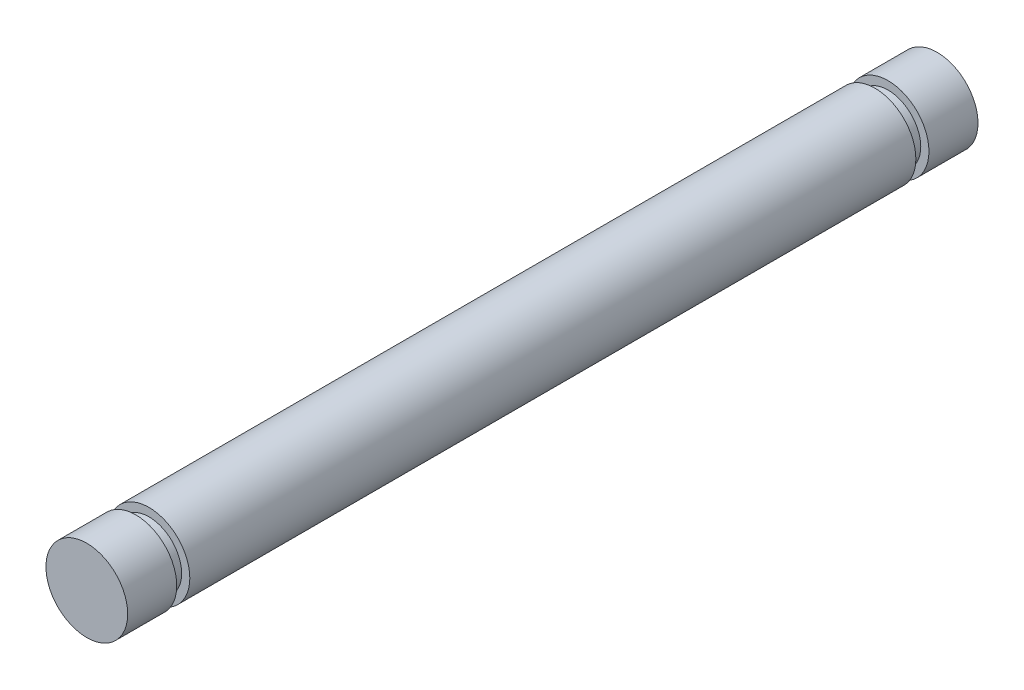
from build123d import *


with BuildPart() as part:
    # Sketch1 → Revolve1 (revolve)
    with BuildSketch(Plane(origin=(0, 0, 0), x_dir=(0, 0, -1), z_dir=(1, 0, 0))):
        Polygon((-26, 0), (26, 0), (26, 2.5), (23, 2.5), (23, 2), (22.2, 2), (22.2, 2.5), (-22.2, 2.5), (-22.2, 2), (-23, 2), (-23, 2.5), (-26, 2.5), align=None)
    revolve(axis=Axis((0, 0, 26), (0, 0, -1)))


solid = part.part
